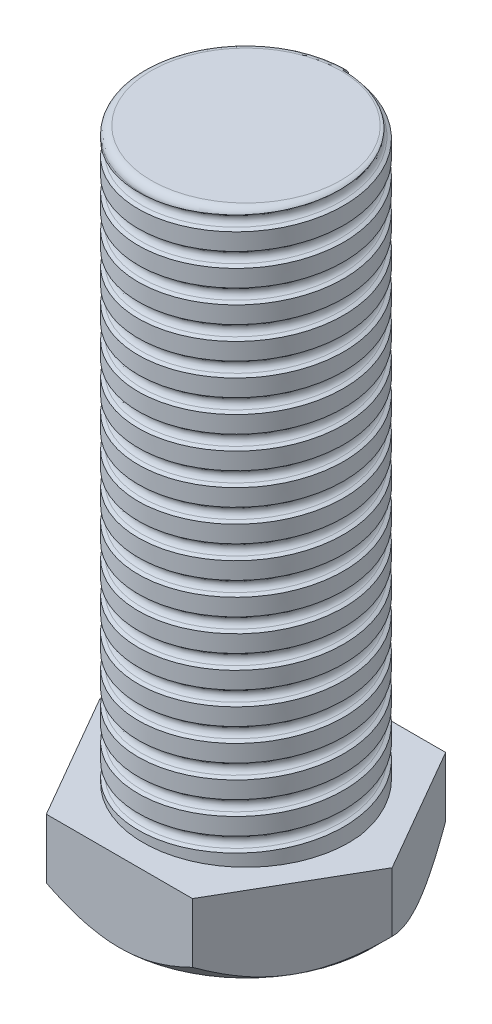
from build123d import *

# Parameters (mm, degrees)
BOSS_EXTRUDE1_DEPTH = 5
SKETCH2_R           = 6.5
BOSS_EXTRUDE2_DEPTH = 36
SKETCH3_OUTSIDE_W   = 180.022
SKETCH3_OUTSIDE_H   = 177.546
SKETCH3_OUTSIDE_R   = 8
CUT_EXTRUDE1_DEPTH  = 75
CUT_EXTRUDE1_DRAFT  = -45
FILLET1_R           = 0.5
CUT_SWEEP1_PITCH    = 2
CUT_SWEEP1_TO       = 36


with BuildPart() as part:
    # Sketch1 → Boss-Extrude1 (new body)
    with BuildSketch(Plane(origin=(0, 0, 0), x_dir=(1, 0, 0), z_dir=(0, 1, 0))):
        Polygon((4.618802154, -8), (9.237604307, 0), (4.618802154, 8), (-4.618802154, 8), (-9.237604307, 0), (-4.618802154, -8), align=None)
    extrude(amount=BOSS_EXTRUDE1_DEPTH)

    # Sketch2 → Boss-Extrude2 (add)
    with BuildSketch(Plane(origin=(0, 5, 0), x_dir=(1, 0, 0), z_dir=(0, 1, 0))):
        with Locations(Location((0, 0, 0), (0, 0, 270))):
            Circle(SKETCH2_R)
    extrude(amount=BOSS_EXTRUDE2_DEPTH)


with BuildPart() as cut_extrude1_tool:
    # Sketch3 outside → Cut-Extrude1 (with draft: the straight prism first)
    with BuildSketch(Plane.XZ):
        Rectangle(SKETCH3_OUTSIDE_W, SKETCH3_OUTSIDE_H)
        Circle(SKETCH3_OUTSIDE_R, mode=Mode.SUBTRACT)
    extrude(amount=-CUT_EXTRUDE1_DEPTH)
    # Cut-Extrude1: the draft: its side faces are tilted about the plane it starts from
    cut_extrude1_sides = [cut_extrude1_tool.faces().sort_by_distance(p)[0] for p in [
        (0, 37.5, -88.773),
        (90.011, 37.5, 0),
        (0, 37.5, 88.773),
        (-90.011, 37.5, 0),
        (-8, 37.5, 0),
    ]]
    draft(cut_extrude1_sides, Plane.XZ, CUT_EXTRUDE1_DRAFT)


with BuildPart() as part_1:
    add(part.part)

    # Cut-Extrude1: cut by cut_extrude1_tool
    add(cut_extrude1_tool.part, mode=Mode.SUBTRACT)

    # Fillet1
    fillet1_edges = [part_1.edges().sort_by_distance(p)[0] for p in [
        (0, 41, -6.5),
    ]]
    fillet(fillet1_edges, radius=FILLET1_R)

    # Cut-Sweep1: arcs per turn and ends read off the stored shape
    # Cut-Sweep1: the profile of Sketch7 screwed along a right-hand helix through 18.6 turns, 10 arcs to a turn; built about Z, then put on its axis
    cut_sweep1_z = Axis((0, 0, 0), (0, 0, 1))
    cut_sweep1_corners = [(6.9, 0, -0.692820323), (6.3, 0, -0.346410162), (6.094309563, 0, 0), (6.3, 0, 0.346410162), (6.9, 0, 0.692820323)]
    with BuildLine(mode=Mode.PRIVATE) as cut_sweep1_profile:
        Line(cut_sweep1_corners[0], cut_sweep1_corners[1])
        Line(cut_sweep1_corners[3], cut_sweep1_corners[4])
        Line(cut_sweep1_corners[4], cut_sweep1_corners[0])
        ThreePointArc((6.3, 0, -0.346410162), (6.149607314, 0, -0.20143768), (6.094309563, 0, 0))
        ThreePointArc((6.094309563, 0, 0), (6.149607314, 0, 0.20143768), (6.3, 0, 0.346410162))
    cut_sweep1_cap = Face(cut_sweep1_profile.wire())
    cut_sweep1_arcs = [((6.3, 0, -0.346410162), (6.094309563, 0, -0.234272221), (6.094309563, 0, 0), (1, 0.8598444972420278, 1)), ((6.094309563, 0, 0), (6.094309563, 0, 0.234272221), (6.3, 0, 0.346410162), (1, 0.8598444972420278, 1))]  # start, shoulder, end, weights
    cut_sweep1_turn_angles = [0, 18, 36, 54, 72, 90, 108, 126, 144, 162, 180, 198, 216, 234, 252, 270, 288, 306, 324, 342, 360]
    cut_sweep1_turn_weights = [1, 0.9510565162951535, 1, 0.9510565162951535, 1, 0.9510565162951535, 1, 0.9510565162951535, 1, 0.9510565162951535, 1, 0.9510565162951535, 1, 0.9510565162951535, 1, 0.9510565162951535, 1, 0.9510565162951535, 1, 0.9510565162951535, 1]
    cut_sweep1_turn_rails = [Edge.make_bspline([Vector(p[0], p[1], 0).rotate(cut_sweep1_z, cut_sweep1_turn_angles[k]) / cut_sweep1_turn_weights[k] + Vector(0, 0, p[2] + CUT_SWEEP1_PITCH * cut_sweep1_turn_angles[k] / 360) for k in range(21)], [0, 0, 0, 1, 1, 2, 2, 3, 3, 4, 4, 5, 5, 6, 6, 7, 7, 8, 8, 9, 9, 10, 10, 10], 2, cut_sweep1_turn_weights) for p in cut_sweep1_corners]
    cut_sweep1_turn_sides = [*[Face.make_surface_from_curves(cut_sweep1_turn_rails[p[0]], cut_sweep1_turn_rails[p[1]]) for p in [(0, 1), (3, 4), (4, 0)]], *[Face.make_bezier_surface([[Vector(p[j][0], p[j][1], 0).rotate(cut_sweep1_z, cut_sweep1_turn_angles[2 * i + k]) / cut_sweep1_turn_weights[2 * i + k] + Vector(0, 0, p[j][2] + CUT_SWEEP1_PITCH * cut_sweep1_turn_angles[2 * i + k] / 360) for k in range(3)] for j in range(3)], [[p[3][j] * cut_sweep1_turn_weights[2 * i + k] for k in range(3)] for j in range(3)]) for p in cut_sweep1_arcs for i in range(10)]]
    cut_sweep1_last_angles = [6480, 6498, 6516, 6534, 6552, 6570, 6588, 6606, 6624, 6642, 6660, 6678, 6696]
    cut_sweep1_last_weights = [1, 0.9510565162951535, 1, 0.9510565162951535, 1, 0.9510565162951535, 1, 0.9510565162951535, 1, 0.9510565162951535, 1, 0.9510565162951535, 1]
    cut_sweep1_last_rails = [Edge.make_bspline([Vector(p[0], p[1], 0).rotate(cut_sweep1_z, cut_sweep1_last_angles[k]) / cut_sweep1_last_weights[k] + Vector(0, 0, p[2] + CUT_SWEEP1_PITCH * cut_sweep1_last_angles[k] / 360) for k in range(13)], [0, 0, 0, 1, 1, 2, 2, 3, 3, 4, 4, 5, 5, 6, 6, 6], 2, cut_sweep1_last_weights) for p in cut_sweep1_corners]
    cut_sweep1_last_sides = [*[Face.make_surface_from_curves(cut_sweep1_last_rails[p[0]], cut_sweep1_last_rails[p[1]]) for p in [(0, 1), (3, 4), (4, 0)]], *[Face.make_bezier_surface([[Vector(p[j][0], p[j][1], 0).rotate(cut_sweep1_z, cut_sweep1_last_angles[2 * i + k]) / cut_sweep1_last_weights[2 * i + k] + Vector(0, 0, p[j][2] + CUT_SWEEP1_PITCH * cut_sweep1_last_angles[2 * i + k] / 360) for k in range(3)] for j in range(3)], [[p[3][j] * cut_sweep1_last_weights[2 * i + k] for k in range(3)] for j in range(3)]) for p in cut_sweep1_arcs for i in range(6)]]
    cut_sweep1 = Plane(origin=(0, 41, 0), x_dir=(0, 0, -1), z_dir=(0, -1, 0)) * split(Solid(Shell([*[p.moved(Location((0, 0, CUT_SWEEP1_PITCH * i))) for i in range(18) for p in cut_sweep1_turn_sides], *cut_sweep1_last_sides, cut_sweep1_cap, cut_sweep1_cap.rotate(cut_sweep1_z, 6696).moved(Location((0, 0, CUT_SWEEP1_PITCH * 6696 / 360)))])), bisect_by=Plane.XY.offset(CUT_SWEEP1_TO), keep=Keep.BOTTOM, mode=Mode.PRIVATE)
    add(cut_sweep1, mode=Mode.SUBTRACT)


solid = part_1.part
